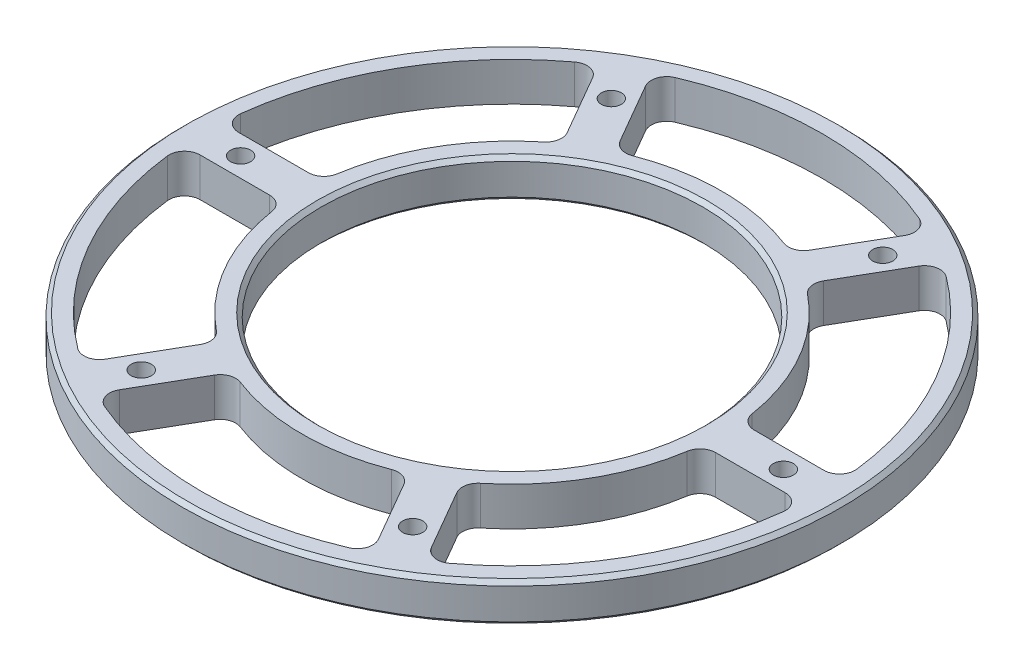
from build123d import *

# Parameters (mm, degrees)
SKETCH2_W                  = 35.78733
SKETCH2_H                  = 10
F_6_0_204_DIAMETER_HOLE1_D = 5.1816
CIRPATTERN3_COUNT          = 6
CUT_EXTRUDE1_DEPTH         = 121.623141229
FILLET1_R                  = 4
CIRPATTERN4_COUNT          = 6
FILLET1_OF_CIRPATTERN4_R   = 4
CHAMFER1_SIZE              = 1
CHAMFER2_SIZE              = 1


with BuildPart() as part:
    # Sketch2 → Revolve1 (revolve)
    with BuildSketch(Plane(origin=(0, 0, 0), x_dir=(0, 0, -1), z_dir=(1, 0, 0))):
        with Locations((-67.106165, 5)):
            Rectangle(SKETCH2_W, SKETCH2_H)
    revolve(axis=Axis((0, -0.75, 0), (0, 1, 0)))

    # #6 (0.204) Diameter Hole1 (through all)
    with Locations(Plane(origin=(0, 10, 0), x_dir=(1, 0, 0), z_dir=(0, 1, 0))):
        with Locations((-35, 60.621778265)):
            f_6_0_204_diameter_hole1 = Hole(F_6_0_204_DIAMETER_HOLE1_D / 2)

    # CirPattern3: #6 (0.204) Diameter Hole1 ×6 about axis
    cirpattern3_axis = Axis((0, -0.75, 0), (0, 1, 0))
    for i in range(1, CIRPATTERN3_COUNT):
        add(f_6_0_204_diameter_hole1.rotate(cirpattern3_axis, i * 360 / CIRPATTERN3_COUNT), mode=Mode.SUBTRACT)

    # Sketch8 → Cut-Extrude1 (cut, through all)
    with BuildSketch(Plane(origin=(0, 10, 0), x_dir=(1, 0, 0), z_dir=(0, 1, 0))):
        with BuildLine():
            Line((-22.660589701, 49.249292692), (-35.591586371, 71.646435917))
            ThreePointArc((-35.591586371, 71.646435917), (0, 79.99983), (35.591586371, 71.646435917))
            Line((35.591586371, 71.646435917), (22.660589701, 49.249292692))
            ThreePointArc((22.660589701, 49.249292692), (0, 54.2125), (-22.660589701, 49.249292692))
        make_face()
    cut_extrude1 = extrude(amount=-CUT_EXTRUDE1_DEPTH, mode=Mode.SUBTRACT)

    # Fillet1
    fillet1_edges = [part.edges().sort_by_distance(p)[0] for p in [
        (-22.660589701, 5, -49.249292692),
        (22.660589701, 5, -49.249292692),
        (35.591586371, 5, -71.646435917),
        (-35.591586371, 5, -71.646435917),
    ]]
    fillet(fillet1_edges, radius=FILLET1_R)

    # CirPattern4: Cut-Extrude1 ×6 about axis
    cirpattern4_axis = Axis((0, -0.75, 0), (0, 1, 0))
    for i in range(1, CIRPATTERN4_COUNT):
        add(cut_extrude1.rotate(cirpattern4_axis, i * 360 / CIRPATTERN4_COUNT), mode=Mode.SUBTRACT)

    # Fillet1 of CirPattern4
    fillet1_of_cirpattern4_edges = [part.edges().sort_by_distance(p)[0] for p in [
        (-53.98143344, 5, -5),
        (-31.320843739, 5, -44.249292692),
        (-44.251840409, 5, -66.646435917),
        (-79.84342678, 5, -5),
        (-31.320843739, 5, 44.249292692),
        (-53.98143344, 5, 5),
        (-79.84342678, 5, 5),
        (-44.251840409, 5, 66.646435917),
        (22.660589701, 5, 49.249292692),
        (-22.660589701, 5, 49.249292692),
        (-35.591586371, 5, 71.646435917),
        (35.591586371, 5, 71.646435917),
        (53.98143344, 5, 5),
        (31.320843739, 5, 44.249292692),
        (44.251840409, 5, 66.646435917),
        (79.84342678, 5, 5),
        (31.320843739, 5, -44.249292692),
        (53.98143344, 5, -5),
        (79.84342678, 5, -5),
        (44.251840409, 5, -66.646435917),
    ]]
    fillet(fillet1_of_cirpattern4_edges, radius=FILLET1_OF_CIRPATTERN4_R)

    # Chamfer1
    chamfer1_edges = [part.edges().sort_by_distance(p)[0] for p in [
        (0, 10, -49.2125),
        (0, 0, -49.2125),
    ]]
    chamfer(chamfer1_edges, length=CHAMFER1_SIZE)

    # Chamfer2
    chamfer2_edges = [part.edges().sort_by_distance(p)[0] for p in [
        (0, 10, -84.99983),
        (0, 0, -84.99983),
    ]]
    chamfer(chamfer2_edges, length=CHAMFER2_SIZE)


solid = part.part
